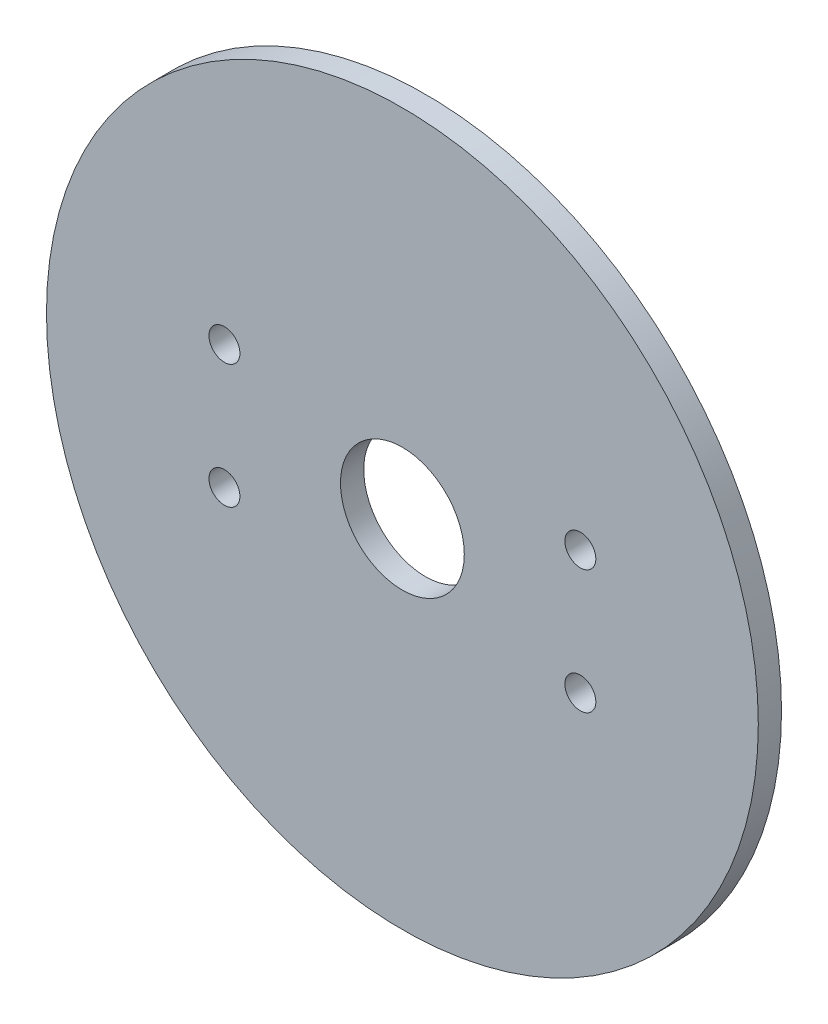
from build123d import *

# Parameters (mm, degrees)
SKETCH_1_R          = 46
EXTRUDE_1_DEPTH     = 3
SKETCH_2_R          = 8
CUT_EXTRUDE_1_DEPTH = 3
SKETCH_3_R          = 2
CUT_EXTRUDE_2_DEPTH = 3


with BuildPart() as part:
    # 스케치1 → 보스-돌출1 (new body)
    with BuildSketch(Plane.XY):
        Circle(SKETCH_1_R)
    extrude(amount=EXTRUDE_1_DEPTH)

    # 스케치2 → 컷-돌출1 (cut)
    with BuildSketch(Plane.XY.offset(3)):
        Circle(SKETCH_2_R)
    extrude(amount=-CUT_EXTRUDE_1_DEPTH, mode=Mode.SUBTRACT)

    # 스케치3 → 컷-돌출2 (cut)
    with BuildSketch(Plane.XY.offset(3)):
        with Locations((-23, 8)):
            Circle(SKETCH_3_R)
        with Locations((-23, -8)):
            Circle(SKETCH_3_R)
        with Locations((23, -8)):
            Circle(SKETCH_3_R)
        with Locations((23, 8)):
            Circle(SKETCH_3_R)
    extrude(amount=-CUT_EXTRUDE_2_DEPTH, mode=Mode.SUBTRACT)


solid = part.part
